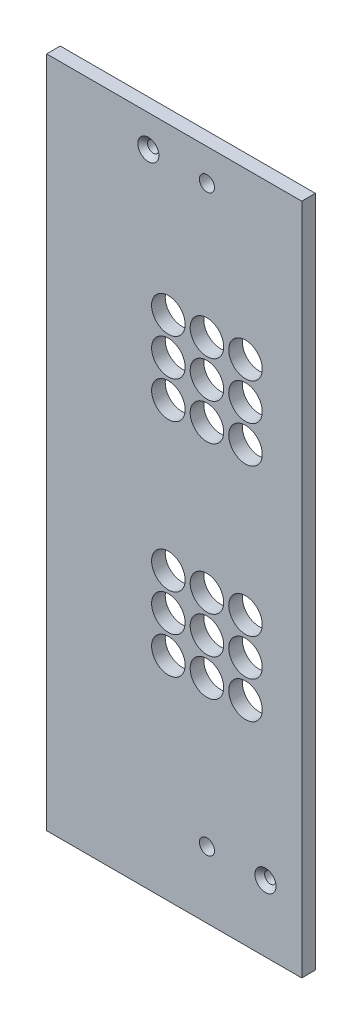
from build123d import *

# Parameters (mm, degrees)
SKETCH1_W                                       = 56.55
SKETCH1_H                                       = 197.425
BOSS_EXTRUDE1_DEPTH                             = 4.064
SKETCH2_R                                       = 5
CUT_EXTRUDE1_DEPTH                              = 103.762587439
SKETCH5_W                                       = 4.064
SKETCH5_H                                       = 197.425
BOSS_EXTRUDE2_DEPTH                             = 19.525
SKETCH14_W                                      = 76.075
SKETCH14_H                                      = 4.064
BOSS_EXTRUDE3_DEPTH                             = 3.175
M4_CLEARANCE_HOLE1_D                            = 4.5
CSK_FOR_M3_FLAT_HEAD_MACHINE_SCREW1_D           = 3.4
CSK_FOR_M3_FLAT_HEAD_MACHINE_SCREW1_CSINK_D     = 6.3
CSK_FOR_M3_FLAT_HEAD_MACHINE_SCREW1_CSINK_ANGLE = 90


with BuildPart() as part:
    # Sketch1 → Boss-Extrude1 (new body)
    with BuildSketch(Plane.XY):
        Rectangle(SKETCH1_W, SKETCH1_H)
    extrude(amount=BOSS_EXTRUDE1_DEPTH)

    # Sketch2 → Cut-Extrude1 (cut, through all)
    with BuildSketch(Plane(origin=(0, 0, 0), x_dir=(-1, 0, 0), z_dir=(0, 0, -1))):
        with Locations((-11.5, 30.630837161)):
            Circle(SKETCH2_R)
        with Locations((-11.5, 52.630837161)):
            Circle(SKETCH2_R)
        with Locations((-11.5, 41.630837161)):
            Circle(SKETCH2_R)
        with Locations((0, 52.630837161)):
            Circle(SKETCH2_R)
        with Locations((0, 41.630837161)):
            Circle(SKETCH2_R)
        with Locations((0, 30.630837161)):
            Circle(SKETCH2_R)
        with Locations((11.5, 30.630837161)):
            Circle(SKETCH2_R)
        with Locations((11.5, 41.630837161)):
            Circle(SKETCH2_R)
        with Locations((11.5, 52.630837161)):
            Circle(SKETCH2_R)
        with Locations((-11.5, -35.369162839)):
            Circle(SKETCH2_R)
        with Locations((-11.5, -13.369162839)):
            Circle(SKETCH2_R)
        with Locations((-11.5, -24.369162839)):
            Circle(SKETCH2_R)
        with Locations((0, -13.369162839)):
            Circle(SKETCH2_R)
        with Locations((0, -24.369162839)):
            Circle(SKETCH2_R)
        with Locations((0, -35.369162839)):
            Circle(SKETCH2_R)
        with Locations((11.5, -35.369162839)):
            Circle(SKETCH2_R)
        with Locations((11.5, -13.369162839)):
            Circle(SKETCH2_R)
        with Locations((11.5, -24.369162839)):
            Circle(SKETCH2_R)
    extrude(amount=-CUT_EXTRUDE1_DEPTH, mode=Mode.SUBTRACT)

    # Sketch5 → Boss-Extrude2 (add)
    with BuildSketch(Plane.ZY.offset(28.275)):
        with Locations((2.032, 0)):
            Rectangle(SKETCH5_W, SKETCH5_H)
    extrude(amount=BOSS_EXTRUDE2_DEPTH)

    # Sketch14 → Boss-Extrude3 (add)
    with BuildSketch(Plane(origin=(0, 98.7125, 0), x_dir=(1, 0, 0), z_dir=(0, 1, 0))):
        with Locations((-9.7625, -2.032)):
            Rectangle(SKETCH14_W, SKETCH14_H)
    extrude(amount=BOSS_EXTRUDE3_DEPTH)

    # M4 Clearance Hole1 (through all)
    with Locations(Plane.XY.offset(4.064)):
        with Locations((0, 92.3625001), (0, -78.8874999)):
            Hole(M4_CLEARANCE_HOLE1_D / 2)

    # CSK for M3 Flat Head Machine Screw1 (through all)
    with Locations(Plane.XY.offset(4.064)):
        with Locations((17.4625, -78.8874999), (-17.4625, 92.3625001)):
            CounterSinkHole(CSK_FOR_M3_FLAT_HEAD_MACHINE_SCREW1_D / 2, CSK_FOR_M3_FLAT_HEAD_MACHINE_SCREW1_CSINK_D / 2, counter_sink_angle=CSK_FOR_M3_FLAT_HEAD_MACHINE_SCREW1_CSINK_ANGLE)


solid = part.part
